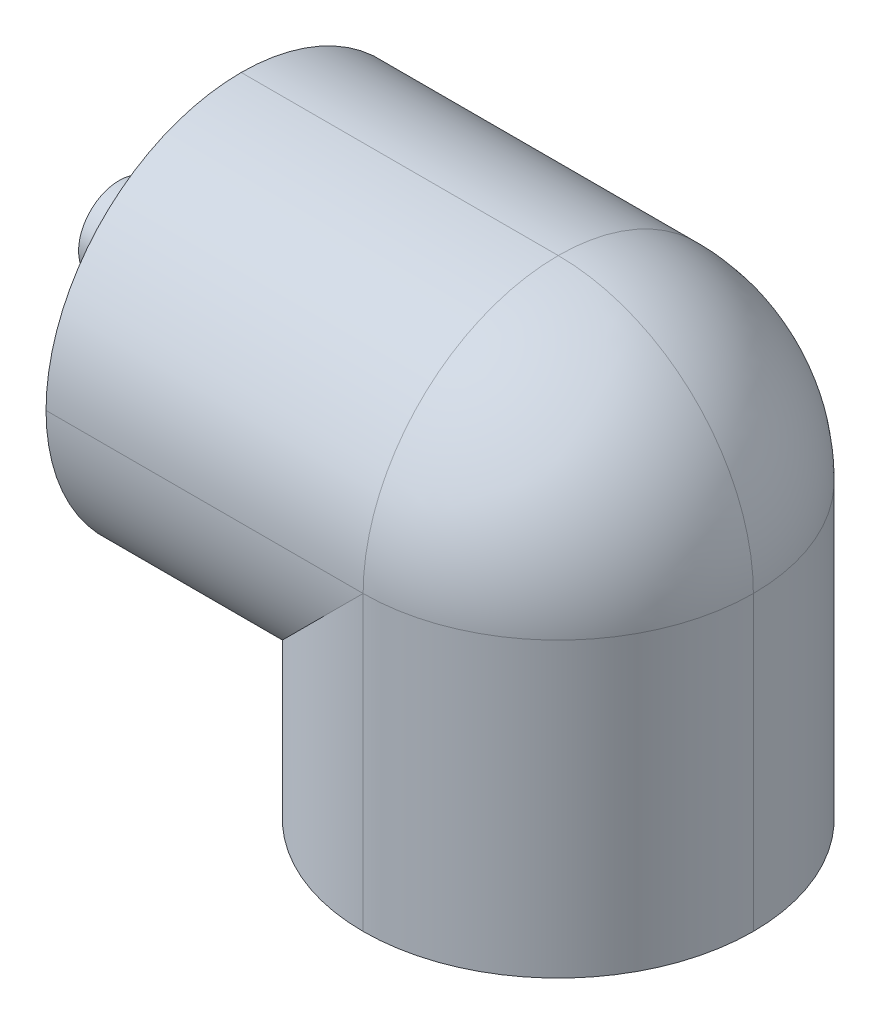
from build123d import *

# Parameters (mm, degrees)
SKETCH1_W           = 48
SKETCH1_H           = 48
BOSS_EXTRUDE1_DEPTH = 30
SKETCH3_W           = 48
SKETCH3_H           = 48
BOSS_EXTRUDE2_DEPTH = 15
FILLET1_R           = 24
SKETCH4_R           = 5
CUT_EXTRUDE1_DEPTH  = 15
SKETCH5_R           = 5
BOSS_EXTRUDE3_DEPTH = 15


with BuildPart() as part:
    # Sketch1 → Boss-Extrude1 (new, symmetric)
    with BuildSketch(Plane(origin=(0, 0, 0), x_dir=(1, 0, 0), z_dir=(0, 1, 0))):
        with Locations((24, 24)):
            Rectangle(SKETCH1_W, SKETCH1_H)
    extrude(amount=BOSS_EXTRUDE1_DEPTH, both=True)

    # Sketch3 → Boss-Extrude2 (add)
    with BuildSketch(Plane.ZY):
        with Locations((-24, 6)):
            Rectangle(SKETCH3_W, SKETCH3_H)
    extrude(amount=BOSS_EXTRUDE2_DEPTH)

    # Fillet1
    fillet1_edges = [part.edges().sort_by_distance(p)[0] for p in [
        (48, 30, -24),
        (0, -24, 0),
        (0, -24, -48),
        (-7.5, -18, -48),
        (16.5, 30, -48),
        (-7.5, -18, 0),
        (48, 0, -48),
        (48, 0, 0),
        (16.5, 30, 0),
    ]]
    fillet(fillet1_edges, radius=FILLET1_R - 0.0001)  # a hair under: the kernel refuses the full size

    # Sketch4 → Cut-Extrude1 (cut)
    with BuildSketch(Plane(origin=(0, -30, 0), x_dir=(-1, 0, 0), z_dir=(0, -1, 0))):
        with Locations(Location((-24, 24, 0), (0, 0, 90))):
            Circle(SKETCH4_R)
    extrude(amount=-CUT_EXTRUDE1_DEPTH, mode=Mode.SUBTRACT)

    # Sketch5 → Boss-Extrude3 (add)
    with BuildSketch(Plane.ZY.offset(15)):
        with Locations((-24, 6)):
            Circle(SKETCH5_R)
    extrude(amount=BOSS_EXTRUDE3_DEPTH)


solid = part.part
